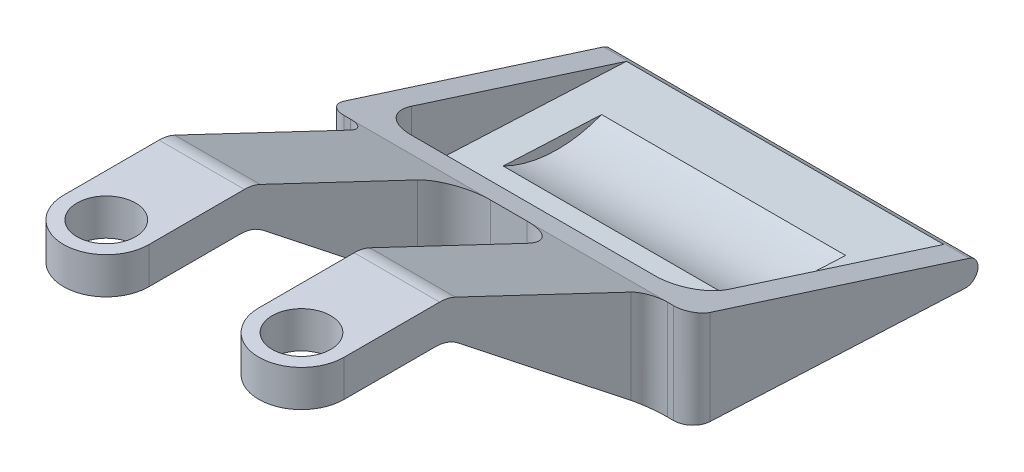
from build123d import *

# Parameters (mm, degrees)
BOSS_EXTRUDE1_DEPTH   = 15
CUT_EXTRUDE1_REACH    = 66.15
SKETCH2_W             = 26
SKETCH2_H             = 30
SKETCH4_W             = 7
SKETCH4_H             = 12
SKETCH4_R             = 2.4
BOSS_EXTRUDE2_DEPTH   = 1.5
BOSS_EXTRUDE2_2_DEPTH = 1.5
BOSS_EXTRUDE3_DEPTH   = 7
BOSS_EXTRUDE4_DEPTH   = 7
FILLET1_R             = 3
FILLET2_R             = 1.5
FILLET3_R             = 1
FILLET4_RADIUS        = 3.5
FILLET4_LENGTH        = 3
FILLET5_RADIUS        = 3.5
FILLET5_LENGTH        = 3
SKETCH3_R             = 10
CUT_EXTRUDE2_DEPTH    = 10


with BuildPart() as part:
    # Sketch1 → Boss-Extrude1 (new, symmetric)
    with BuildSketch(Plane(origin=(0, 0, 0), x_dir=(0, 0, -1), z_dir=(1, 0, 0))):
        Polygon((25, -19.840542805), (25, -28), (55, -29.414764086), align=None)
    extrude(amount=BOSS_EXTRUDE1_DEPTH, both=True)

    # Cut-Extrude1: up to this plane
    cut_extrude1_end = Plane(origin=(0, -24.763733838, 1.167828043), z_dir=(0, -0.99888987496197, 0.0471064507096427))
    # Sketch2 → Cut-Extrude1 (cut, up to the surface)
    with BuildSketch(Plane(origin=(0, 0, 0), x_dir=(1, 0, 0), z_dir=(0, 1, 0)), mode=Mode.PRIVATE) as cut_extrude1_sk1:
        with Locations((0, 42)):
            Rectangle(SKETCH2_W, SKETCH2_H)
    cut_extrude1_tool1 = split(extrude(cut_extrude1_sk1.sketch, amount=-CUT_EXTRUDE1_REACH, mode=Mode.PRIVATE), bisect_by=cut_extrude1_end, keep=Keep.BOTH, mode=Mode.PRIVATE)
    add(cut_extrude1_tool1.solids().sort_by_distance((0, 0, -42))[0], mode=Mode.SUBTRACT)



with BuildPart() as body_2:
    # Sketch4 → Boss-Extrude2 (new, symmetric)
    with BuildSketch(Plane(origin=(0, -13.5, 0), x_dir=(1, 0, 0), z_dir=(0, 1, 0))):
        with Locations((8, 2.5)):
            Rectangle(SKETCH4_W, SKETCH4_H)
        with Locations(Location((8, 0, 0), (0, 0, 90))):
            Circle(SKETCH4_R, mode=Mode.SUBTRACT)
    extrude(amount=BOSS_EXTRUDE2_DEPTH, both=True)


with BuildPart() as body_3:
    # Sketch4 → Boss-Extrude2 2 (new, symmetric)
    with BuildSketch(Plane(origin=(0, -13.5, 0), x_dir=(1, 0, 0), z_dir=(0, 1, 0))):
        with Locations((-8, 2.5)):
            Rectangle(SKETCH4_W, SKETCH4_H)
        with Locations(Location((-8, 0, 0), (0, 0, 270))):
            Circle(SKETCH4_R, mode=Mode.SUBTRACT)
    extrude(amount=BOSS_EXTRUDE2_2_DEPTH, both=True)


with BuildPart() as part_1:
    add(part.part)

    add(body_2.part)  # Boss-Extrude3 merges body 2
    # Sketch5 → Boss-Extrude3 (add)
    with BuildSketch(Plane(origin=(11.5, 0, 0), x_dir=(0, 0, -1), z_dir=(1, 0, 0))):
        Polygon((8.5, -12), (8.5, -15), (25, -28), (25, -19.840542805), align=None)
    extrude(amount=-BOSS_EXTRUDE3_DEPTH)


    add(body_3.part)  # Boss-Extrude4 merges body 3
    # Sketch8 → Boss-Extrude4 (add)
    with BuildSketch(Plane.ZY.offset(11.5)):
        Polygon((-25, -28), (-8.5, -15), (-8.5, -12), (-25, -19.840542805), align=None)
    extrude(amount=-BOSS_EXTRUDE4_DEPTH)

    # Fillet1
    fillet1_edges = [part_1.edges().sort_by_distance(p)[0] for p in [
        (-8, -12, -8.5),
        (-4.5, -23.920271402, -25),
        (-13, -23.285459556, -27),
        (13, -23.285459556, -27),
        (8, -12, -8.5),
        (4.5, -23.920271402, -25),
        (8, -15, -8.5),
        (-8, -15, -8.5),
    ]]
    fillet(fillet1_edges, radius=FILLET1_R)

    # Fillet2
    # the kernel refuses this fillet: 1.5 mm, written as the material it adds along each edge
    with BuildSketch(Plane(origin=(-11.5, -16.090542805, -25), x_dir=(0, 0, 1), z_dir=(0, -1, 0))) as fillet2_piece_1_section:
        with BuildLine():
            CenterArc((FILLET2_R, FILLET2_R), FILLET2_R, 180, 90)
            Line((0, FILLET2_R), (0, 0))
            Line((0, 0), (FILLET2_R, 0))
        make_face()
    fillet2_piece_1 = extrude(amount=15.659457195, mode=Mode.PRIVATE)
    fillet2_piece_1 = split(fillet2_piece_1, bisect_by=Plane(origin=(-11.659708769, -19.629987495, -24.340243021), z_dir=(0, 0.9526614812535883, -0.30403306092548404)), keep=Keep.TOP, mode=Mode.PRIVATE)
    fillet2_piece_1 = split(fillet2_piece_1, bisect_by=Plane(origin=(-11.659708769, -19.543237279, -24.374336535), z_dir=(0, -0.9032129411473199, 0.4291927107302828)), keep=Keep.TOP, mode=Mode.PRIVATE)
    add(fillet2_piece_1)
    with BuildSketch(Plane(origin=(-11.5, -16.090542805, -25), x_dir=(0, 0, 1), z_dir=(0, -1, 0))) as fillet2_piece_2_section:
        with BuildLine():
            CenterArc((FILLET2_R, FILLET2_R), FILLET2_R, 180, 90)
            Line((0, FILLET2_R), (0, 0))
            Line((0, 0), (FILLET2_R, 0))
        make_face()
    fillet2_piece_2 = extrude(amount=15.659457195, mode=Mode.PRIVATE)
    fillet2_piece_2 = split(fillet2_piece_2, bisect_by=Plane(origin=(-11.843159529, -20.103961016, -25.825398338), z_dir=(0, -0.9526614812535883, 0.30403306092548404)), keep=Keep.TOP, mode=Mode.PRIVATE)
    fillet2_piece_2 = split(fillet2_piece_2, bisect_by=Plane(origin=(-11.843159529, -20.428696748, -26.237738291), z_dir=(0, -0.9032129411473199, 0.4291927107302828)), keep=Keep.TOP, mode=Mode.PRIVATE)
    fillet2_piece_2 = split(fillet2_piece_2, bisect_by=Plane(origin=(-11.843159529, -26.204484919, -22.721077013), z_dir=(0, 0.7854916722275349, -0.6188722266035137)), keep=Keep.TOP, mode=Mode.PRIVATE)
    fillet2_piece_2 = split(fillet2_piece_2, bisect_by=Plane(origin=(-11.843159529, -27.974843393, -24.466555432), z_dir=(0, 0.99888987496197, -0.04710645070964269)), keep=Keep.TOP, mode=Mode.PRIVATE)
    add(fillet2_piece_2)
    with BuildSketch(Plane(origin=(11.5, -31.75, -25), x_dir=(1, 0, 0), z_dir=(0, 1, 0))) as fillet2_piece_3_section:
        with BuildLine():
            CenterArc((FILLET2_R, -FILLET2_R), FILLET2_R, 90, 90)
            Line((0, -FILLET2_R), (0, 0))
            Line((0, 0), (FILLET2_R, 0))
        make_face()
    fillet2_piece_3 = extrude(amount=15.659457195, mode=Mode.PRIVATE)
    fillet2_piece_3 = split(fillet2_piece_3, bisect_by=Plane(origin=(11.843159529, -20.103961016, -25.825398338), z_dir=(0, -0.9526614812535883, 0.30403306092548404)), keep=Keep.TOP, mode=Mode.PRIVATE)
    fillet2_piece_3 = split(fillet2_piece_3, bisect_by=Plane(origin=(11.843159529, -27.974843393, -24.466555432), z_dir=(0, 0.99888987496197, -0.04710645070964269)), keep=Keep.TOP, mode=Mode.PRIVATE)
    fillet2_piece_3 = split(fillet2_piece_3, bisect_by=Plane(origin=(11.843159529, -26.204484919, -22.721077013), z_dir=(0, 0.7854916722275349, -0.6188722266035137)), keep=Keep.TOP, mode=Mode.PRIVATE)
    fillet2_piece_3 = split(fillet2_piece_3, bisect_by=Plane(origin=(11.843159529, -20.428696748, -26.237738291), z_dir=(0, -0.9032129411473199, 0.4291927107302828)), keep=Keep.TOP, mode=Mode.PRIVATE)
    add(fillet2_piece_3)
    with BuildSketch(Plane(origin=(11.5, -31.75, -25), x_dir=(1, 0, 0), z_dir=(0, 1, 0))) as fillet2_piece_4_section:
        with BuildLine():
            CenterArc((FILLET2_R, -FILLET2_R), FILLET2_R, 90, 90)
            Line((0, -FILLET2_R), (0, 0))
            Line((0, 0), (FILLET2_R, 0))
        make_face()
    fillet2_piece_4 = extrude(amount=15.659457195, mode=Mode.PRIVATE)
    fillet2_piece_4 = split(fillet2_piece_4, bisect_by=Plane(origin=(11.659708769, -19.629987495, -24.340243021), z_dir=(0, 0.9526614812535883, -0.30403306092548404)), keep=Keep.TOP, mode=Mode.PRIVATE)
    fillet2_piece_4 = split(fillet2_piece_4, bisect_by=Plane(origin=(11.659708769, -19.543237279, -24.374336535), z_dir=(0, -0.9032129411473199, 0.4291927107302828)), keep=Keep.TOP, mode=Mode.PRIVATE)
    add(fillet2_piece_4)
    # the kernel refuses this fillet: 1.5 mm, written as the material it takes off along each edge
    with BuildSketch(Plane(origin=(-15, -16.090542805, -25), x_dir=(1, 0, 0), z_dir=(0, -1, 0)), Plane(origin=(15, -16.090542805, -25), x_dir=(0, 0, -1), z_dir=(0, -1, 0))) as fillet2_2_piece_1:
        with BuildLine():
            CenterArc((FILLET2_R, -FILLET2_R), FILLET2_R, 90, 90)
            Line((0, -FILLET2_R), (0, 0))
            Line((0, 0), (FILLET2_R, 0))
        make_face()
    extrude(amount=15.659457195, mode=Mode.SUBTRACT)

    # Fillet3
    fillet3_edges = [part_1.edges().sort_by_distance(p)[0] for p in [
        (0, -29.414764086, -55),
    ]]
    fillet(fillet3_edges, radius=FILLET3_R)

    # Fillet4: full round fillet: the end face becomes a half cylinder, R = half its width
    fillet4_face = Plane((8, -13.5, 3.5), x_dir=(0, 1, 0), z_dir=(0, 0, 1))  # on the end face: x along it, z out of the body
    fillet4_slab = fillet4_face.offset(-FILLET4_RADIUS / 2) * Box(FILLET4_LENGTH, 2 * FILLET4_RADIUS, FILLET4_RADIUS, mode=Mode.PRIVATE)  # the body's end, R deep
    fillet4_round = Plane((8, -13.5, 0), x_dir=(0, 0, 1), z_dir=(0, 1, 0)) * Cylinder(FILLET4_RADIUS, FILLET4_LENGTH, mode=Mode.PRIVATE)  # its axis R under the face
    add(fillet4_slab - fillet4_round, mode=Mode.SUBTRACT)

    # Fillet5: full round fillet: the end face becomes a half cylinder, R = half its width
    fillet5_face = Plane((-8, -13.5, 3.5), x_dir=(0, 1, 0), z_dir=(0, 0, 1))  # on the end face: x along it, z out of the body
    fillet5_slab = fillet5_face.offset(-FILLET5_RADIUS / 2) * Box(FILLET5_LENGTH, 2 * FILLET5_RADIUS, FILLET5_RADIUS, mode=Mode.PRIVATE)  # the body's end, R deep
    fillet5_round = Plane((-8, -13.5, 0), x_dir=(0, 0, 1), z_dir=(0, 1, 0)) * Cylinder(FILLET5_RADIUS, FILLET5_LENGTH, mode=Mode.PRIVATE)  # its axis R under the face
    add(fillet5_slab - fillet5_round, mode=Mode.SUBTRACT)

    # Sketch3 → Cut-Extrude2 (cut, symmetric)
    with BuildSketch(Plane(origin=(0, 0, 0), x_dir=(0, 0, -1), z_dir=(1, 0, 0))):
        with Locations((39, -17.5)):
            Circle(SKETCH3_R)
    extrude(amount=CUT_EXTRUDE2_DEPTH, both=True, mode=Mode.SUBTRACT)


solid = part_1.part
